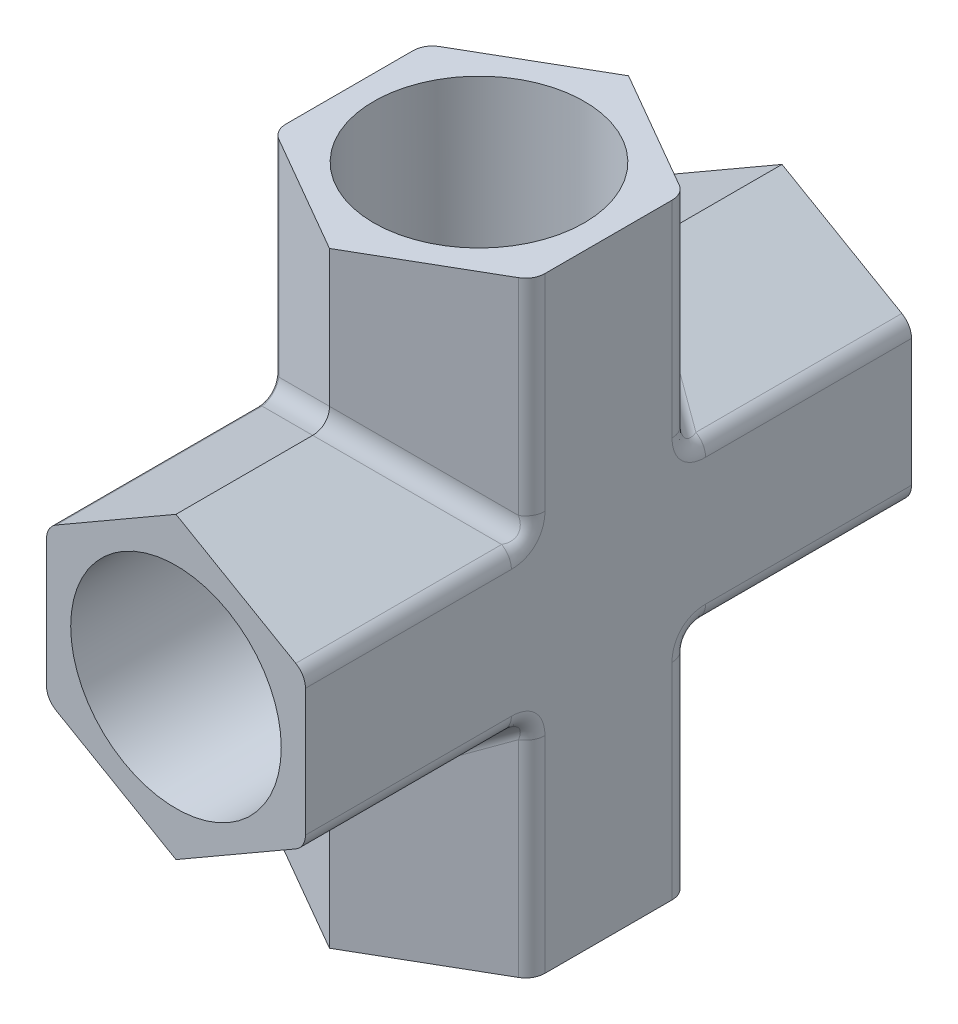
from build123d import *

# Parameters (mm, degrees)
Y_KSEKLIK_EKSTR_ZYON1_DEPTH      = 62.6
Y_KSEKLIK_EKSTR_ZYON3_DEPTH      = 31.3
Y_KSEKLIK_EKSTR_ZYON3_DEPTH_BACK = 31.3
IZIM3_R                          = 10.875
KES_EKSTR_ZYON1_DEPTH            = 70
IZIM4_R                          = 10.875
KES_EKSTR_ZYON2_DEPTH            = 70
FILLET1_R                        = 2


with BuildPart() as part:
    # Çizim1 → Yükseklik-Ekstrüzyon1 (new body)
    with BuildSketch(Plane.XY):
        Polygon((0, -15.444119701), (13.375, -7.72205985), (13.375, 7.72205985), (0, 15.444119701), (-13.375, 7.72205985), (-13.375, -7.72205985), align=None)
    extrude(amount=Y_KSEKLIK_EKSTR_ZYON1_DEPTH)

    # Çizim2 → Yükseklik-Ekstrüzyon3 (add, two sides: drawn at the far end of the back side and taken through both)
    with BuildSketch(Plane(origin=(0, 0, 0), x_dir=(1, 0, 0), z_dir=(0, 1, 0)).offset(-Y_KSEKLIK_EKSTR_ZYON3_DEPTH_BACK)):
        Polygon((0, -15.855880299), (-13.375, -23.57794015), (-13.375, -39.02205985), (0, -46.744119701), (13.375, -39.02205985), (13.375, -23.57794015), align=None)
    extrude(amount=Y_KSEKLIK_EKSTR_ZYON3_DEPTH + Y_KSEKLIK_EKSTR_ZYON3_DEPTH_BACK)

    # Çizim3 → Kes-Ekstrüzyon1 (cut)
    with BuildSketch(Plane.XZ.offset(31.3)):
        with Locations((0, 31.3)):
            Circle(IZIM3_R)
    extrude(amount=-KES_EKSTR_ZYON1_DEPTH, mode=Mode.SUBTRACT)

    # Çizim4 → Kes-Ekstrüzyon2 (cut)
    with BuildSketch(Plane.XY.offset(62.6)):
        Circle(IZIM4_R)
    extrude(amount=-KES_EKSTR_ZYON2_DEPTH, mode=Mode.SUBTRACT)

    # Fillet1
    fillet1_edges = [part.edges().sort_by_distance(p)[0] for p in [
        (-13.375, -7.72205985, 50.811029925),
        (-13.375, 7.72205985, 50.811029925),
        (-13.375, 19.511029925, 23.57794015),
        (-13.375, -19.511029925, 23.57794015),
        (-6.6875, -11.583089776, 42.883089776),
        (-13.375, -19.511029925, 39.02205985),
        (-6.6875, 11.583089776, 42.883089776),
        (-13.375, 19.511029925, 39.02205985),
        (-6.6875, 11.583089776, 19.716910224),
        (-13.375, 7.72205985, 11.788970075),
        (-6.6875, -11.583089776, 19.716910224),
        (-13.375, -7.72205985, 11.788970075),
        (6.6875, 11.583089776, 19.716910224),
        (13.375, 7.72205985, 11.788970075),
        (13.375, 19.511029925, 23.57794015),
        (6.6875, 11.583089776, 42.883089776),
        (13.375, 19.511029925, 39.02205985),
        (13.375, 7.72205985, 50.811029925),
        (13.375, -7.72205985, 50.811029925),
        (6.6875, -11.583089776, 42.883089776),
        (13.375, -19.511029925, 39.02205985),
        (6.6875, -11.583089776, 19.716910224),
        (13.375, -7.72205985, 11.788970075),
        (13.375, -19.511029925, 23.57794015),
    ]]
    fillet(fillet1_edges, radius=FILLET1_R)


solid = part.part
